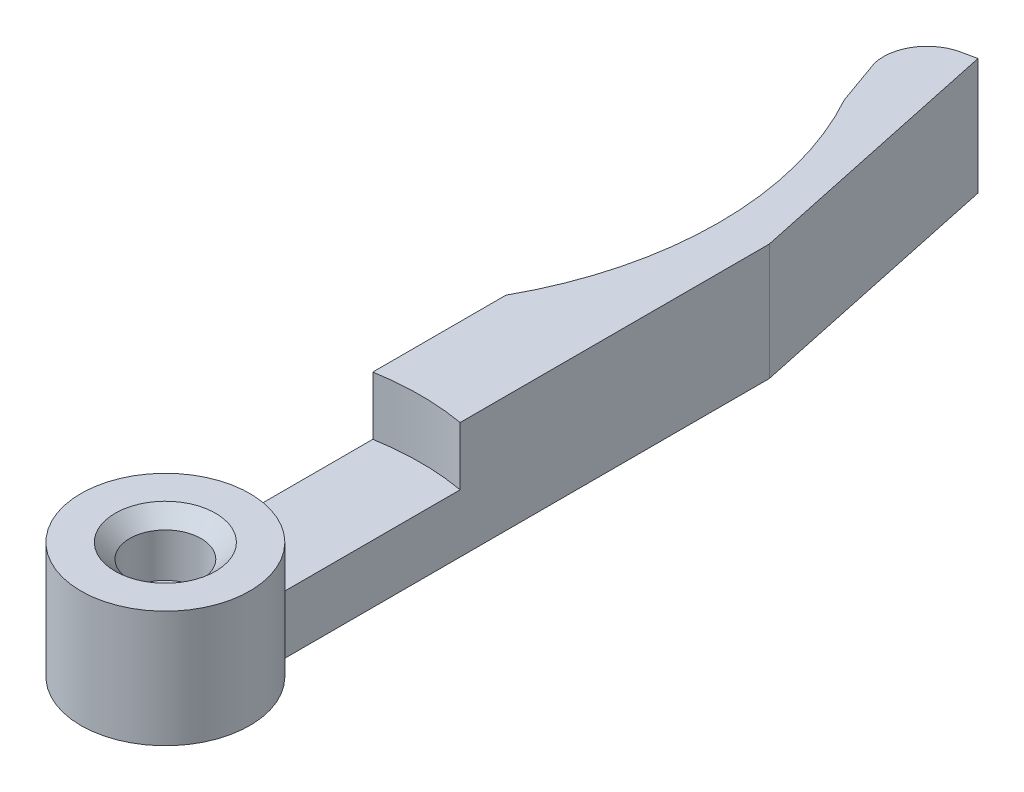
from build123d import *

# Parameters (mm, degrees)
BOSS_EXTRU_1_DEPTH      = 8
ESQUISSE2_R             = 2.45
ENL_V_MAT_EXTRU_1_DEPTH = 4
ENL_V_MAT_EXTRU_2_REACH = 59.094
ESQUISSE3_R             = 1.75
ESQUISSE4_R             = 3.75
ENL_V_MAT_EXTRU_3_DEPTH = 2.5
ENL_V_START             = -4
ENL_V_MAT_EXTRU_4_DEPTH = 4
CHANFREIN1_SIZE         = 1


with BuildPart() as part:
    # Esquisse1 → Boss.-Extru.1 (new body)
    with BuildSketch(Plane(origin=(0, 0, 0), x_dir=(1, 0, 0), z_dir=(0, 1, 0))):
        with BuildLine():
            Line((-3, 26.381049961), (-3, 4.963869458))
            ThreePointArc((-3, 4.963869458), (0, -5.8), (3, 4.963869458))
            Line((3, 4.963869458), (3, 38.463869458))
            Line((3, 38.463869458), (-0.867157449, 56.657414832))
            Line((-0.867157449, 56.657414832), (-1.84530505, 56.449503141))
            ThreePointArc((-1.84530505, 56.449503141), (-3.756758837, 55.119060789), (-4.140414176, 52.821988519))
            Line((-4.140414176, 52.821988519), (-3, 49.618950039))
            ThreePointArc((-3, 49.618950039), (0, 38), (-3, 26.381049961))
        make_face()
    extrude(amount=BOSS_EXTRU_1_DEPTH)

    # Esquisse2 → Enlèv. mat.-Extru.1 (cut)
    with BuildSketch(Plane(origin=(0, 8, 0), x_dir=(1, 0, 0), z_dir=(0, 1, 0))):
        Circle(ESQUISSE2_R)
    extrude(amount=-ENL_V_MAT_EXTRU_1_DEPTH, mode=Mode.SUBTRACT)

    # Esquisse3 → Enlèv. mat.-Extru.2 (cut, up to next)
    with BuildSketch(Plane(origin=(0, 4, 0), x_dir=(1, 0, 0), z_dir=(0, 1, 0)), mode=Mode.PRIVATE) as enl_v_mat_extru_2_sk1:
        Circle(ESQUISSE3_R)
    enl_v_mat_extru_2_tool1 = extrude(enl_v_mat_extru_2_sk1.sketch, amount=-ENL_V_MAT_EXTRU_2_REACH, mode=Mode.PRIVATE) & part.part
    add(enl_v_mat_extru_2_tool1.solids().sort_by_distance((0, 4, 0))[0], mode=Mode.SUBTRACT)

    # Esquisse4 → Enlèv. mat.-Extru.3 (cut)
    with BuildSketch(Plane.XZ):
        Circle(ESQUISSE4_R)
    extrude(amount=-ENL_V_MAT_EXTRU_3_DEPTH, mode=Mode.SUBTRACT)

    # Esquisse5 → Enlèv. mat.-Extru.4 (cut)
    with BuildSketch(Plane(origin=(0, 8, 0), x_dir=(1, 0, 0), z_dir=(0, 1, 0)).offset(ENL_V_START)):
        with BuildLine():
            Line((-3, 4.963869458), (-3, 17.24093965))
            ThreePointArc((-3, 17.24093965), (0, 17.5), (3, 17.24093965))
            Line((3, 17.24093965), (3, 4.963869458))
            ThreePointArc((3, 4.963869458), (0, 5.8), (-3, 4.963869458))
        make_face()
    extrude(amount=ENL_V_MAT_EXTRU_4_DEPTH, mode=Mode.SUBTRACT)

    # Chanfrein1
    chanfrein1_edges = [part.edges().sort_by_distance(p)[0] for p in [
        (-2.45, 8, 0),
    ]]
    chamfer(chanfrein1_edges, length=CHANFREIN1_SIZE)


solid = part.part
